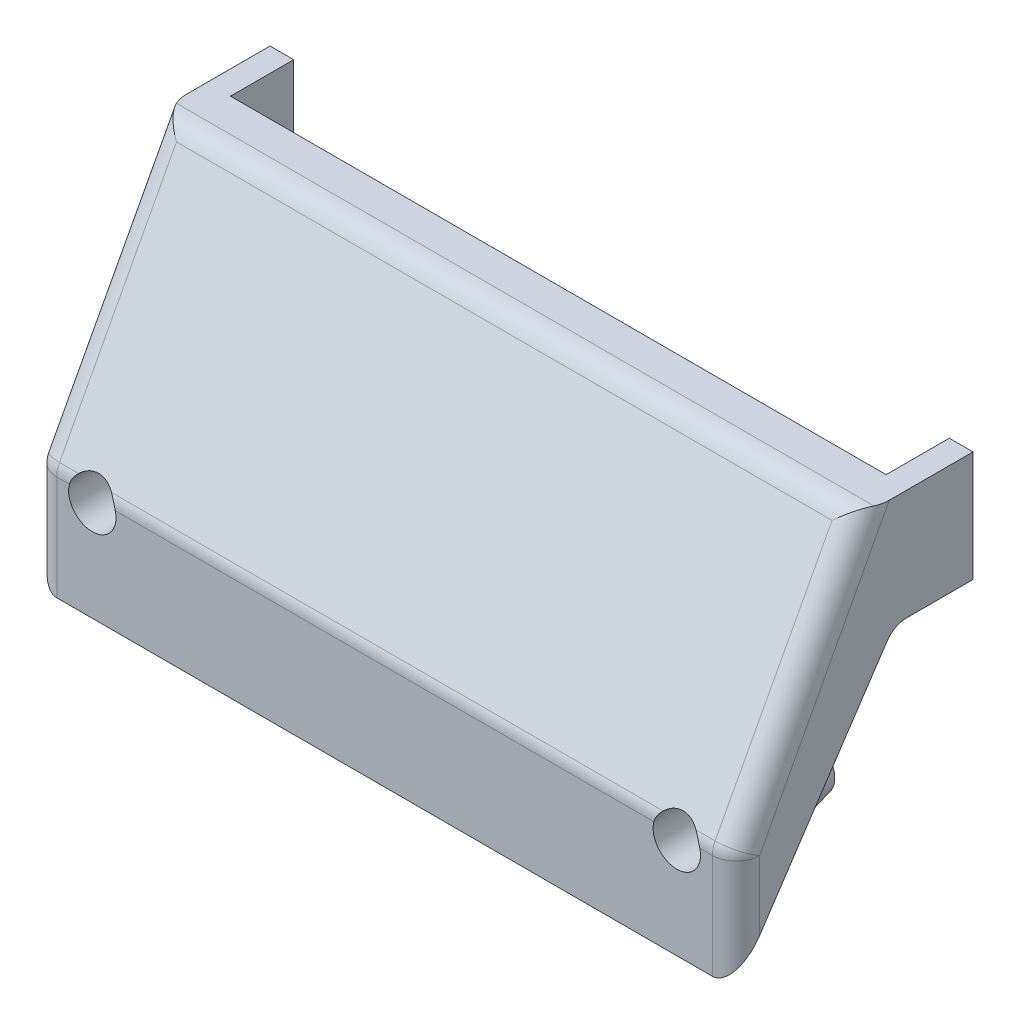
from build123d import *
from build123d.topology import SkipClean

# Parameters (mm, degrees)
ESBO_O1_W                = 89
ESBO_O1_H                = 44
RESSALTO_EXTRUS_O1_DEPTH = 30
CORTE_EXTRUS_O1_DEPTH    = 103.08329932
CHANFRO2_SIZE            = 16
CHANFRO2_SIZE2           = 30
FILETE1_R                = 3
CASCA2_START             = -41.5
CASCA2_DEPTH             = 83
ESBO_O3_W                = 83
ESBO_O3_H                = 8
CORTE_EXTRUS_O2_DEPTH    = 70.399207488
FILETE2_R                = 3
FILETE3_R                = 3
ESBO_O4_R                = 1.75
CORTE_EXTRUS_O3_DEPTH    = 67.934669641
ESBO_O5_R                = 4
ESBO_O5_R_2              = 1.75
RESSALTO_EXTRUS_O2_DEPTH = 10
ESBO_O6_R                = 3
ESBO_O6_R_2              = 1.75
RESSALTO_EXTRUS_O3_DEPTH = 4
ESBO_O7_R                = 3
CORTE_EXTRUS_O4_DEPTH    = 11
CHANFRO3_SIZE2           = 4
CHANFRO3_SIZE            = 1
CHANFRO4_SIZE2           = 4
CHANFRO4_SIZE            = 1
ESBO_O8_W                = 83
ESBO_O8_H                = 3
CORTE_EXTRUS_O5_DEPTH    = 2


# Read off the part's stored shape, not the designer's step: Casca2
with BuildPart() as part:
    # Esboço1 → Ressalto-extrusão1 (new body)
    with BuildSketch(Plane.XY):
        with Locations((0, -18)):
            Rectangle(ESBO_O1_W, ESBO_O1_H)
    extrude(amount=RESSALTO_EXTRUS_O1_DEPTH)

    # Esboço2 → Corte-extrusão1 (cut, through all)
    with BuildSketch(Plane(origin=(44.5, 0, 0), x_dir=(0, 0, -1), z_dir=(1, 0, 0))):
        Polygon((-30, -40), (-10, -10), (0, -10), (0, -40), align=None)
    extrude(amount=-CORTE_EXTRUS_O1_DEPTH, mode=Mode.SUBTRACT)

    # Chanfro2
    chanfro2_edges = [part.edges().sort_by_distance(p)[0] for p in [
        (0, 4, 30),
    ]]
    chanfro2_side = [part.faces().sort_by_distance(p)[0] for p in [
        (0, 4, 15),
    ]]
    chamfer(chanfro2_edges, length=CHANFRO2_SIZE, length2=CHANFRO2_SIZE2, reference=chanfro2_side[0])

    # Filete1
    filete1_edges = [part.edges().sort_by_distance(p)[0] for p in [
        (44.5, -33, 30),
        (-44.5, -33, 30),
        (0, -26, 30),
        (-44.5, -11, 22),
        (0, 4, 14),
        (44.5, -11, 22),
    ]]
    fillet(filete1_edges, radius=FILETE1_R)

    # Casca2 outline → Casca2 (cut)
    with BuildSketch(Plane.YZ.offset(CASCA2_START)):
        Polygon((-35.5, 27), (-7, 8), (-7, 0), (1, 0), (1, 12.2), (-26.75, 27), align=None)
    extrude(amount=CASCA2_DEPTH, mode=Mode.SUBTRACT)

    # Esboço3 → Corte-extrusão2 (cut, through all)
    with BuildSketch(Plane(origin=(0, 4, 0), x_dir=(1, 0, 0), z_dir=(0, 1, 0))):
        with Locations((0, -4)):
            Rectangle(ESBO_O3_W, ESBO_O3_H)
    extrude(amount=-CORTE_EXTRUS_O2_DEPTH, mode=Mode.SUBTRACT)

    # Filete2
    filete2_edges = [part.edges().sort_by_distance(p)[0] for p in [
        (-43, -10, 10),
        (43, -10, 10),
    ]]
    fillet(filete2_edges, radius=FILETE2_R)

    # Filete3
    filete3_edges = [part.edges().sort_by_distance(p)[0] for p in [
        (-41.5, -12.875, 19.6),
        (41.5, -12.875, 19.6),
    ]]
    fillet(filete3_edges, radius=FILETE3_R)

    # Esboço4 → Corte-extrusão3 (cut, through all)
    with BuildSketch(Plane.XY.offset(30)):
        with Locations(Location((-37, -27.5, 0), (0, 0, 25.376933525))):
            Circle(ESBO_O4_R)
        with Locations(Location((37, -27.5, 0), (0, 0, 154.623066475))):
            Circle(ESBO_O4_R)
    extrude(amount=-CORTE_EXTRUS_O3_DEPTH, mode=Mode.SUBTRACT)

    # Esboço5 → Ressalto-extrusão2 (add)
    # profile 1 of 2: a face of its own
    with SkipClean():  # the faces are left unmerged after this step: merging them gives an invalid solid
        with BuildSketch(Plane(origin=(0, 0, 27), x_dir=(-1, 0, 0), z_dir=(0, 0, -1))):
            with Locations(Location((-37, -27.5, 0), (0, 0, 200.496286961))):
                Circle(ESBO_O5_R)
            with Locations(Location((-37, -27.5, 0), (0, 0, 154.623066475))):
                Circle(ESBO_O5_R_2, mode=Mode.SUBTRACT)
        # profile 2 of 2: a face of its own
        with BuildSketch(Plane(origin=(0, 0, 27), x_dir=(-1, 0, 0), z_dir=(0, 0, -1))):
            with Locations(Location((37, -27.5, 0), (0, 0, 180))):
                Circle(ESBO_O5_R)
            with Locations(Location((37, -27.5, 0), (0, 0, 180))):
                Circle(ESBO_O5_R_2, mode=Mode.SUBTRACT)
        extrude(amount=RESSALTO_EXTRUS_O2_DEPTH)

    # Esboço6 → Ressalto-extrusão3 (add)
    # profile 1 of 2: a face of its own
    with SkipClean():  # the faces are left unmerged after this step: merging them gives an invalid solid
        with BuildSketch(Plane(origin=(0, 0, 17), x_dir=(-1, 0, 0), z_dir=(0, 0, -1))):
            with Locations((-37, -27.5)):
                Circle(ESBO_O6_R)
            with Locations(Location((-37, -27.5, 0), (0, 0, 154.623066475))):
                Circle(ESBO_O6_R_2, mode=Mode.SUBTRACT)
        # profile 2 of 2: a face of its own
        with BuildSketch(Plane(origin=(0, 0, 17), x_dir=(-1, 0, 0), z_dir=(0, 0, -1))):
            with Locations(Location((37, -27.5, 0), (0, 0, 180))):
                Circle(ESBO_O6_R)
            with Locations(Location((37, -27.5, 0), (0, 0, 180))):
                Circle(ESBO_O6_R_2, mode=Mode.SUBTRACT)
        extrude(amount=RESSALTO_EXTRUS_O3_DEPTH)

    # Esboço7 → Corte-extrusão4 (cut)
    with BuildSketch(Plane.XY.offset(30)):
        with Locations((-37, -27.5)):
            Circle(ESBO_O7_R)
        with Locations(Location((37, -27.5, 0), (0, 0, 180))):
            Circle(ESBO_O7_R)
    extrude(amount=-CORTE_EXTRUS_O4_DEPTH, mode=Mode.SUBTRACT)

    # Chanfro3
    chanfro3_edges = [part.edges().sort_by_distance(p)[0] for p in [
        (-40, -27.5, 17),
    ]]
    chanfro3_side = [part.faces().sort_by_distance(p)[0] for p in [
        (-40.02, -27.5, 17),
    ]]
    chamfer(chanfro3_edges, length=CHANFRO3_SIZE - 0.0001, length2=CHANFRO3_SIZE2 - 0.0001, reference=chanfro3_side[0])  # a hair under: the kernel refuses the full size

    # Chanfro4
    chanfro4_edges = [part.edges().sort_by_distance(p)[0] for p in [
        (40, -27.5, 17),
    ]]
    chanfro4_side = [part.faces().sort_by_distance(p)[0] for p in [
        (40.02, -27.5, 17),
    ]]
    chamfer(chanfro4_edges, length=CHANFRO4_SIZE - 0.0001, length2=CHANFRO4_SIZE2 - 0.0001, reference=chanfro4_side[0])  # a hair under: the kernel refuses the full size

    # Esboço8 → Corte-extrusão5 (cut)
    with BuildSketch(Plane(origin=(0, 0, 8), x_dir=(-1, 0, 0), z_dir=(0, 0, -1))):
        with Locations((0, -8.5)):
            Rectangle(ESBO_O8_W, ESBO_O8_H)
    extrude(amount=-CORTE_EXTRUS_O5_DEPTH, mode=Mode.SUBTRACT)


solid = part.part
